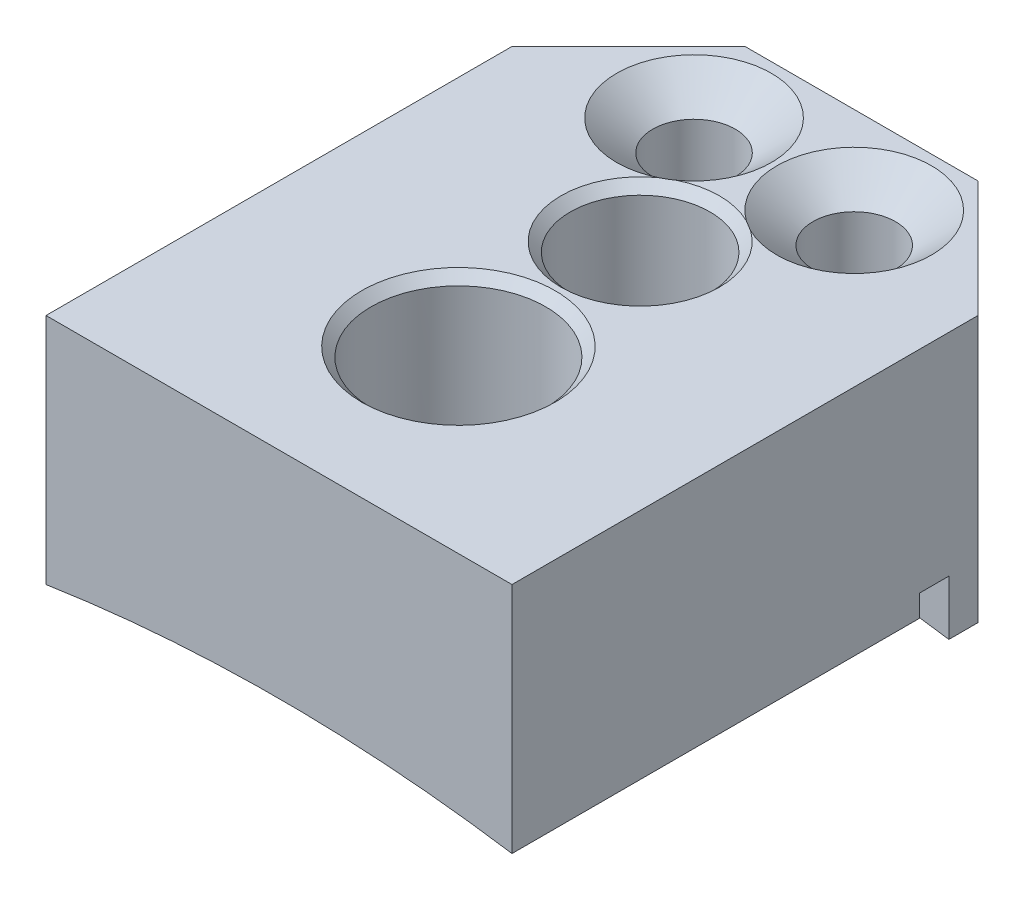
from build123d import *

# Parameters (mm, degrees)
BOSS_EXTRUDE1_DEPTH                               = 12.7
CUT_EXTRUDE1_DEPTH                                = 45.522766139
CUT_EXTRUDE1_DEPTH_BACK                           = 45.522766139
SKETCH2_R                                         = 83.82
BOSS_EXTRUDE2_DEPTH                               = 7.9375
CHAMFER1_SIZE                                     = 6.35
CSK_FOR_8_FLAT_HEAD_MACHINE_SCREW_100_D           = 4.4958
CSK_FOR_8_FLAT_HEAD_MACHINE_SCREW_100_CSINK_D     = 8.4328
CSK_FOR_8_FLAT_HEAD_MACHINE_SCREW_100_CSINK_ANGLE = 100
SKETCH6_R                                         = 1.631947848
SKETCH6_R_2                                       = 1.523937663
CUT_EXTRUDE2_DEPTH                                = 38.304291688
SKETCH7_W                                         = 1.5875
SKETCH7_H                                         = 1.190625
CUT_EXTRUDE3_DEPTH                                = 35.276937503
SKETCH8_R                                         = 4.7625
SKETCH8_R_2                                       = 3.81
CUT_EXTRUDE4_DEPTH                                = 38.304291688
CHAMFER2_SIZE                                     = 0.508


with BuildPart() as part:
    # Sketch1 → Boss-Extrude1 (new body)
    with BuildSketch(Plane(origin=(0, 0, 0), x_dir=(1, 0, 0), z_dir=(0, 1, 0))):
        Polygon((-28.511825699, 12.845271113), (-22.161825699, 19.195271113), (-9.461825699, 19.195271113), (-3.111825699, 12.845271113), (-3.111825699, -12.554728887), (-28.511825699, -12.554728887), align=None)
    extrude(amount=BOSS_EXTRUDE1_DEPTH)

    # Sketch2 → Cut-Extrude1 (cut, two sides: drawn at the far end of the back side and taken through both)
    with BuildSketch(Plane.XY.offset(12.554728887).offset(-CUT_EXTRUDE1_DEPTH_BACK)):
        with Locations((-15.811825699, -82.852292666)):
            Circle(SKETCH2_R)
    extrude(amount=CUT_EXTRUDE1_DEPTH + CUT_EXTRUDE1_DEPTH_BACK, mode=Mode.SUBTRACT)

    # Sketch5 → Boss-Extrude2 (add)
    with BuildSketch(Plane(origin=(0, 0, -19.195271113), x_dir=(-1, 0, 0), z_dir=(0, 0, -1))):
        with BuildLine():
            Line((3.111825699, 12.7), (3.111825699, 0))
            Line((3.111825699, 0), (3.111825699, -1.799225087))
            ThreePointArc((3.111825699, -1.799225087), (15.811825699, -0.810292666), (28.511825699, -1.799225087))
            Line((28.511825699, -1.799225087), (28.511825699, 0))
            Line((28.511825699, 0), (28.511825699, 12.7))
            Line((28.511825699, 12.7), (3.111825699, 12.7))
        make_face()
    extrude(amount=-BOSS_EXTRUDE2_DEPTH)

    # Chamfer1
    chamfer1_edges = [part.edges().sort_by_distance(p)[0] for p in [
        (-3.111825699, 5.450387457, -19.195271113),
        (-28.511825699, 5.450387457, -19.195271113),
    ]]
    chamfer(chamfer1_edges, length=CHAMFER1_SIZE)

    # CSK for #8 Flat Head Machine Screw (100)1 (through all)
    with Locations(Plane(origin=(0, 12.7, 0), x_dir=(1, 0, 0), z_dir=(0, 1, 0))):
        with Locations((-20.177450699, 14.432771113), (-11.446200699, 14.432771113)):
            CounterSinkHole(CSK_FOR_8_FLAT_HEAD_MACHINE_SCREW_100_D / 2, CSK_FOR_8_FLAT_HEAD_MACHINE_SCREW_100_CSINK_D / 2, counter_sink_angle=CSK_FOR_8_FLAT_HEAD_MACHINE_SCREW_100_CSINK_ANGLE)

    # Sketch6 → Cut-Extrude2 (cut, through all)
    with BuildSketch(Plane(origin=(0, 12.7, 0), x_dir=(1, 0, 0), z_dir=(0, 1, 0))):
        with Locations(Location((-15.811825699, 7.130260145, 0), (0, 0, 270))):
            Circle(SKETCH6_R)
        with Locations(Location((-15.811825699, -2.775791253, 0), (0, 0, 270))):
            Circle(SKETCH6_R_2)
    extrude(amount=-CUT_EXTRUDE2_DEPTH, mode=Mode.SUBTRACT)

    # Sketch7 → Cut-Extrude3 (cut, through all)
    with BuildSketch(Plane.ZY.offset(28.511825699)):
        with Locations((-10.464021113, 0.5953125)):
            Rectangle(SKETCH7_W, SKETCH7_H)
    extrude(amount=-CUT_EXTRUDE3_DEPTH, mode=Mode.SUBTRACT)

    # Sketch8 → Cut-Extrude4 (cut, through all)
    with BuildSketch(Plane(origin=(0, 12.7, 0), x_dir=(1, 0, 0), z_dir=(0, 1, 0))):
        with Locations(Location((-15.811825699, -2.775791253, 0), (0, 0, 270))):
            Circle(SKETCH8_R)
        with Locations(Location((-15.811825699, 7.130260145, 0), (0, 0, 270))):
            Circle(SKETCH8_R_2)
    extrude(amount=-CUT_EXTRUDE4_DEPTH, mode=Mode.SUBTRACT)

    # Chamfer2
    # the kernel refuses this chamfer: 0.508 mm, written as the material it takes off along each edge
    with BuildSketch(Plane(origin=(-15.811825699, 12.7, 2.775791253), x_dir=(0, 0, 1), z_dir=(-1, 0, 0))) as chamfer2_piece_1:
        Polygon((4.7625 + CHAMFER2_SIZE, 0), (4.7625, -CHAMFER2_SIZE), (4.7625, 0), align=None)
    revolve(axis=Axis((-15.811825699, 12.7, 2.775791253), (0, 1, 0)), mode=Mode.SUBTRACT)
    with BuildSketch(Plane(origin=(-15.811825699, 12.7, -7.130260145), x_dir=(0, 0, 1), z_dir=(-1, 0, 0))) as chamfer2_piece_2:
        Polygon((3.81 + CHAMFER2_SIZE, 0), (3.81, -CHAMFER2_SIZE), (3.81, 0), align=None)
    revolve(axis=Axis((-15.811825699, 12.7, -7.130260145), (0, 1, 0)), mode=Mode.SUBTRACT)


solid = part.part
